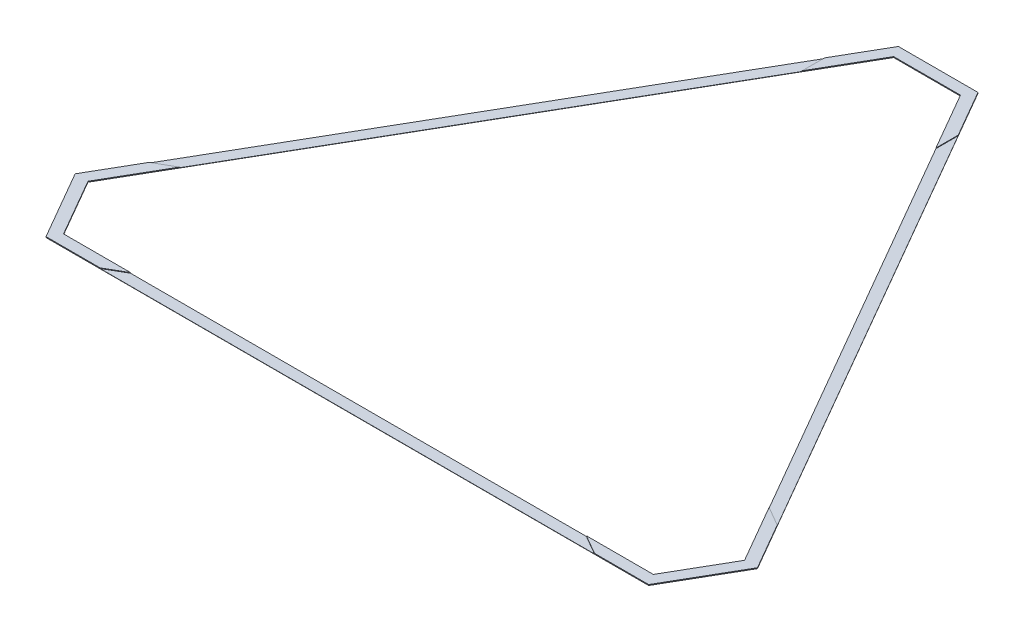
from build123d import *

# Parameters (mm, degrees)
BOSS_EXTRUDE1_DEPTH = 1.27
BOSS_EXTRUDE2_DEPTH = 2.65684


with BuildPart() as part:
    # Sketch1 → Boss-Extrude1 (new body)
    with BuildSketch(Plane(origin=(0, 0, 0), x_dir=(1, 0, 0), z_dir=(0, 1, 0))):
        Polygon((181.729393675, 1693.246045791), (-181.729393675, 1693.246045791), (-1557.25878735, -689.240751359), (-1375.529393675, -1004.005294432), (1375.529393675, -1004.005294432), (1557.25878735, -689.240751359), align=None)
        Polygon((-1498.6, -689.240751359), (-152.4, 1642.446045791), (152.4, 1642.446045791), (1498.6, -689.240751359), (1346.2, -953.205294432), (-1346.2, -953.205294432), align=None, mode=Mode.SUBTRACT)
    extrude(amount=BOSS_EXTRUDE1_DEPTH)

    # Sketch2 → Boss-Extrude2 (add)
    with BuildSketch(Plane(origin=(0, 1.27, 0), x_dir=(1, 0, 0), z_dir=(0, 1, 0))):
        Polygon((-181.729393675, 1693.246045791), (-305.308, 1479.201620907), (-305.308, 1377.601620907), (-152.4, 1642.446045791), (152.4, 1642.446045791), (305.308, 1377.601620907), (305.308, 1479.201620907), (181.729393675, 1693.246045791), align=None)
        Polygon((-1345.692, -424.396326475), (-1433.680181024, -475.196326475), (-1557.25878735, -689.240751359), (-1375.529393675, -1004.005294432), (-1128.372181024, -1004.005294432), (-1040.384, -953.205294432), (-1346.2, -953.205294432), (-1498.6, -689.240751359), align=None)
        Polygon((1557.25878735, -689.240751359), (1433.680181024, -475.196326475), (1345.692, -424.396326475), (1498.6, -689.240751359), (1346.2, -953.205294432), (1040.384, -953.205294432), (1128.372181024, -1004.005294432), (1375.529393675, -1004.005294432), align=None)
    extrude(amount=BOSS_EXTRUDE2_DEPTH)


solid = part.part
